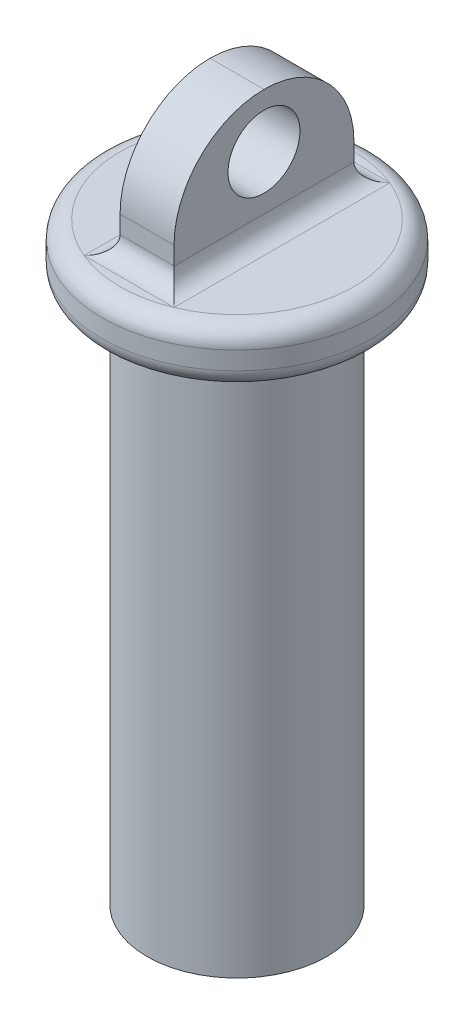
from build123d import *

# Parameters (mm, degrees)
SKETCH1_R           = 5
BOSS_EXTRUDE1_DEPTH = 30
SKETCH4_R           = 7.5
BOSS_EXTRUDE3_DEPTH = 3
SKETCH5_W           = 3
SKETCH5_H           = 10
BOSS_EXTRUDE4_DEPTH = 7
SKETCH6_R           = 2
CUT_EXTRUDE2_DEPTH  = 7
FILLET1_R           = 1
FILLET2_R           = 5


with BuildPart() as part:
    # Sketch1 → Boss-Extrude1 (new body)
    with BuildSketch(Plane(origin=(0, 0, 0), x_dir=(1, 0, 0), z_dir=(0, 1, 0))):
        with Locations(Location((0, 0, 0), (0, 0, 270))):
            Circle(SKETCH1_R)
    extrude(amount=BOSS_EXTRUDE1_DEPTH)

    # Sketch4 → Boss-Extrude3 (add)
    with BuildSketch(Plane(origin=(0, 30, 0), x_dir=(1, 0, 0), z_dir=(0, 1, 0))):
        with Locations(Location((0, 0, 0), (0, 0, 270))):
            Circle(SKETCH4_R)
    extrude(amount=BOSS_EXTRUDE3_DEPTH)

    # Sketch5 → Boss-Extrude4 (add)
    with BuildSketch(Plane(origin=(0, 33, 0), x_dir=(1, 0, 0), z_dir=(0, 1, 0))):
        Rectangle(SKETCH5_W, SKETCH5_H)
    extrude(amount=BOSS_EXTRUDE4_DEPTH)

    # Sketch6 → Cut-Extrude2 (cut)
    with BuildSketch(Plane(origin=(1.5, 0, 0), x_dir=(0, 0, -1), z_dir=(1, 0, 0))):
        with Locations((0, 37)):
            Circle(SKETCH6_R)
    extrude(amount=-CUT_EXTRUDE2_DEPTH, mode=Mode.SUBTRACT)

    # Fillet1
    fillet1_edges = [part.edges().sort_by_distance(p)[0] for p in [
        (1.5, 33, 0),
        (0, 33, -5),
        (-1.5, 33, 0),
        (0, 33, 5),
        (0, 30, -5),
        (0, 30, -7.5),
        (0, 33, -7.5),
    ]]
    fillet(fillet1_edges, radius=FILLET1_R - 0.0001)  # a hair under: the kernel refuses the full size

    # Fillet2
    fillet2_edges = [part.edges().sort_by_distance(p)[0] for p in [
        (0, 40, -5),
        (0, 40, 5),
    ]]
    fillet(fillet2_edges, radius=FILLET2_R - 0.0001)  # a hair under: the kernel refuses the full size


solid = part.part
